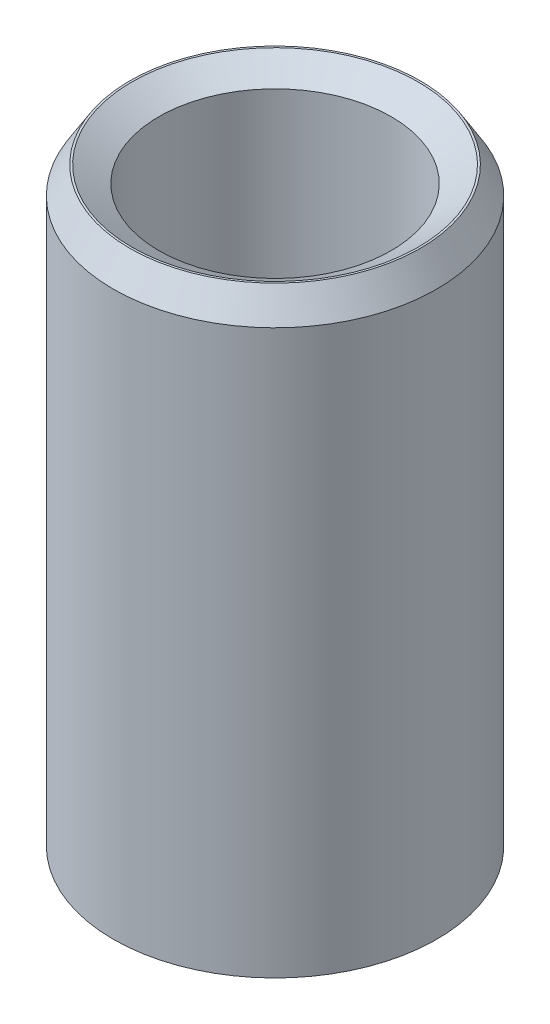
from build123d import *
from OCP.BRepFilletAPI import BRepFilletAPI_MakeChamfer

# Parameters (mm, degrees)
SKETCH1_R           = 15
BOSS_EXTRUDE1_DEPTH = 56.260168822
SKETCH2_R           = 10.771415099
CUT_EXTRUDE1_DEPTH  = 61.126588095
CHAMFER1_SIZE       = 2.505782205
CHAMFER1_SIZE2      = 1.532128157


with BuildPart() as part:
    # Sketch1 → Boss-Extrude1 (new body)
    with BuildSketch(Plane(origin=(0, 0, 0), x_dir=(1, 0, 0), z_dir=(0, 1, 0))):
        Circle(SKETCH1_R)
    extrude(amount=BOSS_EXTRUDE1_DEPTH)

    # Sketch2 → Cut-Extrude1 (cut, through all)
    with BuildSketch(Plane(origin=(0, 0, 0), x_dir=(1, 0, 0), z_dir=(0, 1, 0))):
        Circle(SKETCH2_R)
    extrude(amount=CUT_EXTRUDE1_DEPTH, mode=Mode.SUBTRACT)

    # Chamfer1: one chamfer whose edges measure the first distance from different faces: ONE call of the kernel's chamfer builder (chamfer() names one face for all edges)
    chamfer1_edges_1 = [part.edges().sort_by_distance(p)[0] for p in [
        (-10.771415099, 56.260168822, 0),
    ]]
    chamfer1_side_1 = [part.faces().sort_by_distance(p)[0] for p in [
        (-14.575735931, 56.260168822, 0),
    ]]
    chamfer1_edges_2 = [part.edges().sort_by_distance(p)[0] for p in [
        (-10.771415099, 0, 0),
    ]]
    chamfer1_side_2 = [part.faces().sort_by_distance(p)[0] for p in [
        (-10.771415099, 28.130084411, 0),
    ]]
    chamfer1_edges_3 = [part.edges().sort_by_distance(p)[0] for p in [
        (-15, 0, 0),
    ]]
    chamfer1_side_3 = [part.faces().sort_by_distance(p)[0] for p in [
        (-14.575735931, 0, 0),
    ]]
    chamfer1_edges_4 = [part.edges().sort_by_distance(p)[0] for p in [
        (-15, 56.260168822, 0),
    ]]
    chamfer1_side_4 = [part.faces().sort_by_distance(p)[0] for p in [
        (-15, 28.130084411, 0),
    ]]
    chamfer1 = BRepFilletAPI_MakeChamfer(part.part.solid().wrapped)
    for e in chamfer1_edges_1:
        chamfer1.Add(CHAMFER1_SIZE, CHAMFER1_SIZE2, e.wrapped, chamfer1_side_1[0].wrapped)  # the first distance lies on this face
    for e in chamfer1_edges_2:
        chamfer1.Add(CHAMFER1_SIZE, CHAMFER1_SIZE2, e.wrapped, chamfer1_side_2[0].wrapped)  # the first distance lies on this face
    for e in chamfer1_edges_3:
        chamfer1.Add(CHAMFER1_SIZE, CHAMFER1_SIZE2, e.wrapped, chamfer1_side_3[0].wrapped)  # the first distance lies on this face
    for e in chamfer1_edges_4:
        chamfer1.Add(CHAMFER1_SIZE, CHAMFER1_SIZE2, e.wrapped, chamfer1_side_4[0].wrapped)  # the first distance lies on this face
    add(Compound.cast(chamfer1.Shape()), mode=Mode.REPLACE)


solid = part.part
